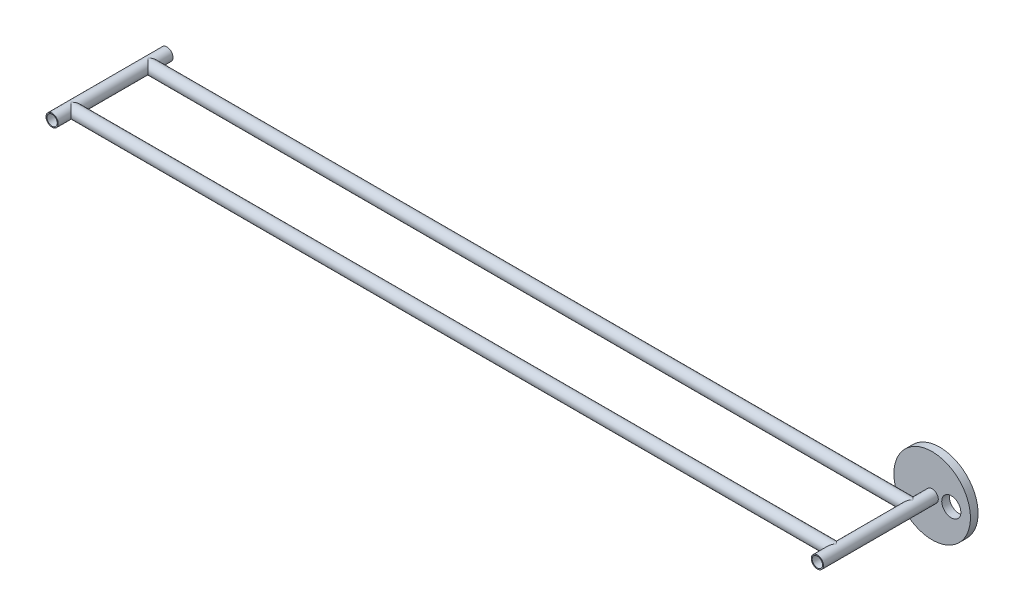
from build123d import *

# Parameters (mm, degrees)
SKETCH1_R                = 8
SKETCH1_R_2              = 6.75
BOSS_EXTRUDE1_DEPTH      = 1000
BOSS_EXTRUDE1_2_DEPTH    = 1000
BOSS_EXTRUDE2_DEPTH      = 75
BOSS_EXTRUDE2_DEPTH_BACK = 75
SKETCH2_R                = 8
SKETCH2_R_2              = 6.75
CUT_EXTRUDE1_START       = -150
SKETCH3_R                = 6.75
CUT_EXTRUDE1_DEPTH       = 150
BOSS_EXTRUDE3_DEPTH      = 75
BOSS_EXTRUDE3_DEPTH_BACK = 75
SKETCH4_R                = 8
SKETCH4_R_2              = 6.75
SKETCH6_R                = 6.75
CUT_EXTRUDE2_DEPTH       = 150
SKETCH7_R                = 50
SKETCH7_R_2              = 6.75
SKETCH7_R_3              = 12.5
BOSS_EXTRUDE4_DEPTH      = 10


with BuildPart() as part:
    # Sketch1 → Boss-Extrude1 (new body)
    with BuildSketch(Plane(origin=(0, 0, 0), x_dir=(0, 0, -1), z_dir=(1, 0, 0))):
        with Locations((-50, 0)):
            Circle(SKETCH1_R)
        with Locations((-50, 0)):
            Circle(SKETCH1_R_2, mode=Mode.SUBTRACT)
    extrude(amount=BOSS_EXTRUDE1_DEPTH)



with BuildPart() as body_2:
    # Sketch1 → Boss-Extrude1 2 (new body)
    with BuildSketch(Plane(origin=(0, 0, 0), x_dir=(0, 0, -1), z_dir=(1, 0, 0))):
        with Locations((50, 0)):
            Circle(SKETCH1_R)
        with Locations((50, 0)):
            Circle(SKETCH1_R_2, mode=Mode.SUBTRACT)
    extrude(amount=BOSS_EXTRUDE1_2_DEPTH)


with BuildPart() as part_1:
    add(part.part)

    add(body_2.part)  # Boss-Extrude2 merges body 2
    # Sketch2 → Boss-Extrude2 (add, two sides: drawn at the far end of the back side and taken through both)
    with BuildSketch(Plane.XY.offset(-BOSS_EXTRUDE2_DEPTH_BACK)):
        Circle(SKETCH2_R)
        Circle(SKETCH2_R_2, mode=Mode.SUBTRACT)
    extrude(amount=BOSS_EXTRUDE2_DEPTH + BOSS_EXTRUDE2_DEPTH_BACK)

    # Sketch3 → Cut-Extrude1 (cut)
    with BuildSketch(Plane.XY.offset(75).offset(CUT_EXTRUDE1_START)):
        Circle(SKETCH3_R)
    extrude(amount=CUT_EXTRUDE1_DEPTH, mode=Mode.SUBTRACT)

    # Sketch4 → Boss-Extrude3 (add, two sides: drawn at the far end of the back side and taken through both)
    with BuildSketch(Plane.XY.offset(-BOSS_EXTRUDE3_DEPTH_BACK)):
        with Locations((1000, 0)):
            Circle(SKETCH4_R)
        with Locations((1000, 0)):
            Circle(SKETCH4_R_2, mode=Mode.SUBTRACT)
    extrude(amount=BOSS_EXTRUDE3_DEPTH + BOSS_EXTRUDE3_DEPTH_BACK)

    # Sketch6 → Cut-Extrude2 (cut)
    with BuildSketch(Plane.XY.offset(75)):
        with Locations((1000, 0)):
            Circle(SKETCH6_R)
    extrude(amount=-CUT_EXTRUDE2_DEPTH, mode=Mode.SUBTRACT)

    # Sketch7 → Boss-Extrude4 (add)
    with BuildSketch(Plane(origin=(0, 0, -75), x_dir=(-1, 0, 0), z_dir=(0, 0, -1))):
        with Locations((-1000, 0)):
            Circle(SKETCH7_R)
        with Locations((-1000, 0)):
            Circle(SKETCH7_R_2, mode=Mode.SUBTRACT)
        with Locations((-1025, 0)):
            Circle(SKETCH7_R_3, mode=Mode.SUBTRACT)
    extrude(amount=BOSS_EXTRUDE4_DEPTH)


solid = part_1.part
